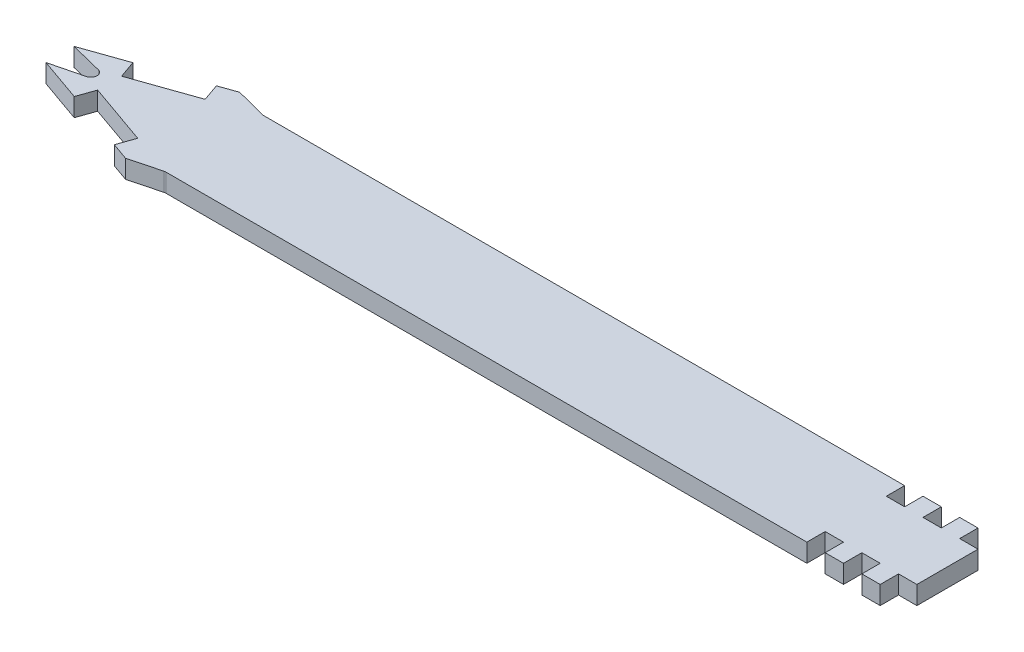
from build123d import *

# Parameters (mm, degrees)
BOSS_EXTRUDE1_DEPTH             = 15
BOSS_EXTRUDE2_REACH             = 1239.023
BOSS_EXTRUDE2_DIRECTION_2_REACH = 1239.023
CUT_EXTRUDE2_DEPTH              = 1238.578280352
CUT_EXTRUDE2_DEPTH_BACK         = 1238.578280352
SKETCH5_W                       = 40
SKETCH5_H                       = 40
CUT_EXTRUDE3_DEPTH              = 1238.578280352
BOSS_EXTRUDE4_DEPTH             = 75
CUT_EXTRUDE4_DEPTH              = 1241.107934819
CUT_EXTRUDE4_DEPTH_BACK         = 1241.107934819
SKETCH8_W                       = 15
SKETCH8_H                       = 73.7
FILLET1_R                       = 5
CUT_EXTRUDE5_DEPTH              = 1241.107934819
CUT_EXTRUDE5_DEPTH_BACK         = 1241.107934819
SKETCH9_W                       = 25
SKETCH9_H                       = 15
SKETCH9_W_2                     = 15
CUT_EXTRUDE6_DEPTH              = 1241.107934819
CUT_EXTRUDE6_DEPTH_BACK         = 1241.107934819
SKETCH10_W                      = 1728.920732784
SKETCH10_H                      = 178.853868908
SKETCH10_W_2                    = 1650
SKETCH10_H_2                    = 15
CUT_EXTRUDE8_DEPTH              = 1238.022635201


with BuildPart() as part:
    # Sketch1 → Boss-Extrude1 (new body)
    with BuildSketch(Plane(origin=(0, 0, 0), x_dir=(1, 0, 0), z_dir=(0, 1, 0))):
        Polygon((-450, 300), (-400, 300), (-200, 250), (600, 40), (1200, 40), (1200, -40), (600, -40), (-200, -250), (-400, -300), (-450, -300), align=None)
    extrude(amount=BOSS_EXTRUDE1_DEPTH)

    # Boss-Extrude2: up to this face of the body (flat: up to its plane)
    boss_extrude2_end = Plane(part.part.faces().sort_by_distance((-425, 7.5, 300))[0])
    # Sketch2 → Boss-Extrude2 (add, up to the picked face)
    with BuildSketch(Plane.XY, mode=Mode.PRIVATE) as boss_extrude2_sk1:
        with BuildLine():
            Line((-425, 0), (-450, 0))
            Line((-450, 0), (-450, -40))
            Line((-450, -40), (-440, -40))
            Line((-440, -40), (-440, -15))
            ThreePointArc((-440, -15), (-435.606601718, -4.393398282), (-425, 0))
        make_face()
    boss_extrude2_tool1 = split(extrude(boss_extrude2_sk1.sketch, amount=BOSS_EXTRUDE2_REACH, mode=Mode.PRIVATE), bisect_by=boss_extrude2_end, keep=Keep.BOTH, mode=Mode.PRIVATE)
    # Sketch2 → Boss-Extrude2 (add, up to the picked face)
    with BuildSketch(Plane.XY, mode=Mode.PRIVATE) as boss_extrude2_sk2:
        with BuildLine():
            Line((-400, 0), (-425, 0))
            ThreePointArc((-425, 0), (-414.393398282, -4.393398282), (-410, -15))
            Line((-410, -15), (-410, -40))
            Line((-410, -40), (-400, -40))
            Line((-400, -40), (-400, 0))
        make_face()
    boss_extrude2_tool2 = split(extrude(boss_extrude2_sk2.sketch, amount=BOSS_EXTRUDE2_REACH, mode=Mode.PRIVATE), bisect_by=boss_extrude2_end, keep=Keep.BOTH, mode=Mode.PRIVATE)
    add(boss_extrude2_tool1.solids().sort_by(Axis((-444.100555, -18.206662, 0), (0, 0, 1)))[0])
    add(boss_extrude2_tool2.solids().sort_by(Axis((-405.899445, -18.206662, 0), (0, 0, 1)))[0])

    # Boss-Extrude2 direction 2: up to this face of the body (flat: up to its plane)
    boss_extrude2_direction_2_end = Plane(part.part.faces().sort_by_distance((-425, 7.5, -300))[0])
    # Sketch2 → Boss-Extrude2 direction 2 (add, up to the picked face)
    with BuildSketch(Plane.XY, mode=Mode.PRIVATE) as boss_extrude2_direction_2_sk1:
        with BuildLine():
            Line((-425, 0), (-450, 0))
            Line((-450, 0), (-450, -40))
            Line((-450, -40), (-440, -40))
            Line((-440, -40), (-440, -15))
            ThreePointArc((-440, -15), (-435.606601718, -4.393398282), (-425, 0))
        make_face()
    boss_extrude2_direction_2_tool1 = split(extrude(boss_extrude2_direction_2_sk1.sketch, amount=-BOSS_EXTRUDE2_DIRECTION_2_REACH, mode=Mode.PRIVATE), bisect_by=boss_extrude2_direction_2_end, keep=Keep.BOTH, mode=Mode.PRIVATE)
    # Sketch2 → Boss-Extrude2 direction 2 (add, up to the picked face)
    with BuildSketch(Plane.XY, mode=Mode.PRIVATE) as boss_extrude2_direction_2_sk2:
        with BuildLine():
            Line((-400, 0), (-425, 0))
            ThreePointArc((-425, 0), (-414.393398282, -4.393398282), (-410, -15))
            Line((-410, -15), (-410, -40))
            Line((-410, -40), (-400, -40))
            Line((-400, -40), (-400, 0))
        make_face()
    boss_extrude2_direction_2_tool2 = split(extrude(boss_extrude2_direction_2_sk2.sketch, amount=-BOSS_EXTRUDE2_DIRECTION_2_REACH, mode=Mode.PRIVATE), bisect_by=boss_extrude2_direction_2_end, keep=Keep.BOTH, mode=Mode.PRIVATE)
    add(boss_extrude2_direction_2_tool1.solids().sort_by(Axis((-444.100555, -18.206662, 0), (0, 0, -1)))[0])
    add(boss_extrude2_direction_2_tool2.solids().sort_by(Axis((-405.899445, -18.206662, 0), (0, 0, -1)))[0])

    # Sketch4 → Cut-Extrude2 (cut, two sides: drawn at the far end of the back side and taken through both)
    with BuildSketch(Plane(origin=(0, 0, 0), x_dir=(1, 0, 0), z_dir=(0, 1, 0)).offset(-CUT_EXTRUDE2_DEPTH_BACK)):
        Polygon((-450, 230), (-400, 230), (-150, 167.5), (-150, -167.5), (-400, -230), (-450, -230), align=None)
        Polygon((-100, 155), (-100, -155), (520, 0), align=None)
    extrude(amount=CUT_EXTRUDE2_DEPTH + CUT_EXTRUDE2_DEPTH_BACK, mode=Mode.SUBTRACT)

    # Sketch5 → Cut-Extrude3 (cut, through all)
    with BuildSketch(Plane(origin=(0, 0, 0), x_dir=(0, 0, -1), z_dir=(1, 0, 0))):
        with Locations((-265, -20)):
            Rectangle(SKETCH5_W, SKETCH5_H)
        with Locations((265, -20)):
            Rectangle(SKETCH5_W, SKETCH5_H)
    extrude(amount=-CUT_EXTRUDE3_DEPTH, mode=Mode.SUBTRACT)

    # Sketch7 → Boss-Extrude4 (add)
    with BuildSketch(Plane(origin=(1200, 0, 0), x_dir=(0, 0, -1), z_dir=(1, 0, 0))):
        with BuildLine():
            Line((-87.5, 50), (-40, 15))
            Line((-40, 15), (40, 15))
            Line((40, 15), (87.5, 50))
            Line((87.5, 50), (87.5, 88.7))
            Line((87.5, 88.7), (58.5, 88.7))
            Line((58.5, 88.7), (58.5, 63.2))
            Line((58.5, 63.2), (48.5, 63.2))
            Line((48.5, 63.2), (48.5, 88.7))
            Line((48.5, 88.7), (20, 88.7))
            Line((20, 88.7), (20, 50))
            ThreePointArc((20, 50), (0, 30), (-20, 50))
            Line((-20, 50), (-20, 88.7))
            Line((-20, 88.7), (-63, 88.7))
            Line((-63, 88.7), (-63, 63.2))
            Line((-63, 63.2), (-73, 63.2))
            Line((-73, 63.2), (-73, 88.7))
            Line((-73, 88.7), (-87.5, 88.7))
            Line((-87.5, 88.7), (-87.5, 50))
        make_face()
    extrude(amount=-BOSS_EXTRUDE4_DEPTH)

    # Sketch8 → Cut-Extrude4 (cut, two sides: drawn at the far end of the back side and taken through both)
    with BuildSketch(Plane.XY.offset(-CUT_EXTRUDE4_DEPTH_BACK)):
        with Locations((1147.5, 51.85)):
            Rectangle(SKETCH8_W, SKETCH8_H)
        with Locations((1177.5, 51.85)):
            Rectangle(SKETCH8_W, SKETCH8_H)
    extrude(amount=CUT_EXTRUDE4_DEPTH + CUT_EXTRUDE4_DEPTH_BACK, mode=Mode.SUBTRACT)

    # Fillet1
    fillet1_edges = [part.edges().sort_by_distance(p)[0] for p in [
        (1192.5, 50, 87.5),
        (1162.5, 50, 87.5),
        (1132.5, 50, 87.5),
        (1192.5, 50, -87.5),
        (1162.5, 50, -87.5),
        (1132.5, 50, -87.5),
        (1192.5, 88.7, -87.5),
        (1162.5, 88.7, -87.5),
        (1132.5, 88.7, -87.5),
        (1132.5, 88.7, -58.5),
        (1162.5, 88.7, -58.5),
        (1192.5, 88.7, -58.5),
        (1192.5, 88.7, -48.5),
        (1162.5, 88.7, -48.5),
        (1132.5, 88.7, -48.5),
        (1192.5, 88.7, -20),
        (1162.5, 88.7, -20),
        (1132.5, 88.7, -20),
        (1192.5, 88.7, 63),
        (1162.5, 88.7, 63),
        (1132.5, 88.7, 63),
        (1132.5, 88.7, 87.5),
        (1162.5, 88.7, 87.5),
        (1192.5, 88.7, 87.5),
        (1192.5, 88.7, 73),
        (1162.5, 88.7, 73),
        (1132.5, 88.7, 73),
        (1192.5, 88.7, 20),
        (1162.5, 88.7, 20),
        (1132.5, 88.7, 20),
        (600, 7.5, 40),
        (600, 7.5, -40),
        (520, 7.5, 0),
        (-440, -40, -292.5),
        (-440, -40, -237.5),
        (-400, -40, -292.5),
        (-400, -40, -237.5),
        (-450, -40, -237.5),
        (-410, -40, -237.5),
        (-450, -40, -292.5),
        (-410, -40, -292.5),
        (-150, 7.5, 167.5),
        (-100, 7.5, 155),
        (-150, 7.5, -167.5),
        (-100, 7.5, -155),
        (-450, -40, 237.5),
        (-410, -40, 237.5),
        (-440, -40, 237.5),
        (-400, -40, 237.5),
        (-450, -40, 292.5),
        (-440, -40, 292.5),
        (-400, -40, 292.5),
        (-410, -40, 292.5),
    ]]
    fillet(fillet1_edges, radius=FILLET1_R - 0.0001)  # a hair under: the kernel refuses the full size

    # Sketch9 → Cut-Extrude5 (cut, two sides: drawn at the far end of the back side and taken through both)
    with BuildSketch(Plane(origin=(0, 0, 0), x_dir=(1, 0, 0), z_dir=(0, 1, 0)).offset(-CUT_EXTRUDE5_DEPTH_BACK)):
        with Locations((-425, -292.5)):
            Rectangle(SKETCH9_W, SKETCH9_H)
        with Locations((1192.5, -32.5)):
            Rectangle(SKETCH9_W_2, SKETCH9_H)
        with Locations((1192.5, 32.5)):
            Rectangle(SKETCH9_W_2, SKETCH9_H)
        with Locations((1162.5, 32.5)):
            Rectangle(SKETCH9_W_2, SKETCH9_H)
        with Locations((1132.5, 32.5)):
            Rectangle(SKETCH9_W_2, SKETCH9_H)
        with Locations((1132.5, -32.5)):
            Rectangle(SKETCH9_W_2, SKETCH9_H)
        with Locations((1162.5, -32.5)):
            Rectangle(SKETCH9_W_2, SKETCH9_H)
        with Locations((-425, -237.5)):
            Rectangle(SKETCH9_W, SKETCH9_H)
        with Locations((-425, 237.5)):
            Rectangle(SKETCH9_W, SKETCH9_H)
        with Locations((-425, 292.5)):
            Rectangle(SKETCH9_W, SKETCH9_H)
    extrude(amount=CUT_EXTRUDE5_DEPTH + CUT_EXTRUDE5_DEPTH_BACK, mode=Mode.SUBTRACT)


with BuildPart() as cut_extrude5_piece_1:
    # of the separate pieces the step leaves, piece 1, a body of its own (cut_extrude5_pieces)
    add(part.part.solids().sort_by_distance((-400, -35.0001, -300))[0])


with BuildPart() as cut_extrude5_piece_2:
    # of the separate pieces the step leaves, piece 2, a body of its own (cut_extrude5_pieces)
    add(part.part.solids().sort_by_distance((1170, 48.501289589, 85.46603587))[0])


with BuildPart() as cut_extrude5_piece_3:
    # of the separate pieces the step leaves, piece 3, a body of its own (cut_extrude5_pieces)
    add(part.part.solids().sort_by_distance((1170, 48.501289589, -85.46603587))[0])


with BuildPart() as cut_extrude5_piece_4:
    # of the separate pieces the step leaves, piece 4, a body of its own (cut_extrude5_pieces)
    add(part.part.solids().sort_by_distance((1125, 83.7001, 73))[0])


with BuildPart() as cut_extrude5_piece_5:
    # of the separate pieces the step leaves, piece 5, a body of its own (cut_extrude5_pieces)
    add(part.part.solids().sort_by_distance((1200, 48.501289589, 85.46603587))[0])


with BuildPart() as cut_extrude5_piece_6:
    # of the separate pieces the step leaves, piece 6, a body of its own (cut_extrude5_pieces)
    add(part.part.solids().sort_by_distance((1200, 48.501289589, -85.46603587))[0])


with BuildPart() as cut_extrude5_piece_7:
    # of the separate pieces the step leaves, piece 7, a body of its own (cut_extrude5_pieces)
    add(part.part.solids().sort_by_distance((1125, 88.7, -40))[0])


with BuildPart() as cut_extrude6_tool:
    # Sketch10 → Cut-Extrude6 (new, two sides: drawn at the far end of the back side and taken through both)
    with BuildSketch(Plane.XY.offset(-CUT_EXTRUDE6_DEPTH_BACK)):
        with Locations((378.379601058, 20.599691165)):
            Rectangle(SKETCH10_W, SKETCH10_H)
        with Locations((375, 7.5)):
            Rectangle(SKETCH10_W_2, SKETCH10_H_2, mode=Mode.SUBTRACT)
    extrude(amount=CUT_EXTRUDE6_DEPTH + CUT_EXTRUDE6_DEPTH_BACK)


with BuildPart() as cut_extrude5_piece_1_1:
    add(cut_extrude5_piece_1.part)

    # Cut-Extrude6: cut by cut_extrude6_tool
    add(cut_extrude6_tool.part, mode=Mode.SUBTRACT)

    # Sketch12 → Cut-Extrude8 (cut, through all)
    with BuildSketch(Plane(origin=(0, 0, 0), x_dir=(1, 0, 0), z_dir=(0, 1, 0))):
        Polygon((474.15750273, -11.460624318), (441.536230577, 0), (474.15750273, 11.460624318), (509.777233765, 23.974678146), (560.316098949, 41.730176601), (574.468123656, 46.70211754), (600.645318554, 55.898785132), (600.645318554, 300), (-450, 300), (-450, -300), (600.645318554, -300), (600.645318554, -55.898785132), (574.468123656, -46.70211754), (560.316098949, -41.730176601), (509.777233765, -23.974678146), align=None)
        Polygon((514.749174704, -9.82265344), (509.777233765, -23.974678146), (560.316098949, -41.730176601), (565.288039888, -27.578151895), align=None)
        Polygon((560.316098949, 41.730176601), (509.777233765, 23.974678146), (514.749174704, 9.82265344), (565.288039888, 27.578151895), align=None)
    extrude(amount=CUT_EXTRUDE8_DEPTH, mode=Mode.SUBTRACT)


with BuildPart() as cut_extrude5_piece_2_1:
    add(cut_extrude5_piece_2.part)

    # Cut-Extrude6: cut by cut_extrude6_tool
    add(cut_extrude6_tool.part, mode=Mode.SUBTRACT)


with BuildPart() as cut_extrude5_piece_3_1:
    add(cut_extrude5_piece_3.part)

    # Cut-Extrude6: cut by cut_extrude6_tool
    add(cut_extrude6_tool.part, mode=Mode.SUBTRACT)


with BuildPart() as cut_extrude5_piece_4_1:
    add(cut_extrude5_piece_4.part)

    # Cut-Extrude6: cut by cut_extrude6_tool
    add(cut_extrude6_tool.part, mode=Mode.SUBTRACT)


with BuildPart() as cut_extrude5_piece_5_1:
    add(cut_extrude5_piece_5.part)

    # Cut-Extrude6: cut by cut_extrude6_tool
    add(cut_extrude6_tool.part, mode=Mode.SUBTRACT)


with BuildPart() as cut_extrude5_piece_6_1:
    add(cut_extrude5_piece_6.part)

    # Cut-Extrude6: cut by cut_extrude6_tool
    add(cut_extrude6_tool.part, mode=Mode.SUBTRACT)


with BuildPart() as cut_extrude5_piece_7_1:
    add(cut_extrude5_piece_7.part)

    # Cut-Extrude6: cut by cut_extrude6_tool
    add(cut_extrude6_tool.part, mode=Mode.SUBTRACT)


solid = cut_extrude5_piece_1_1.part
